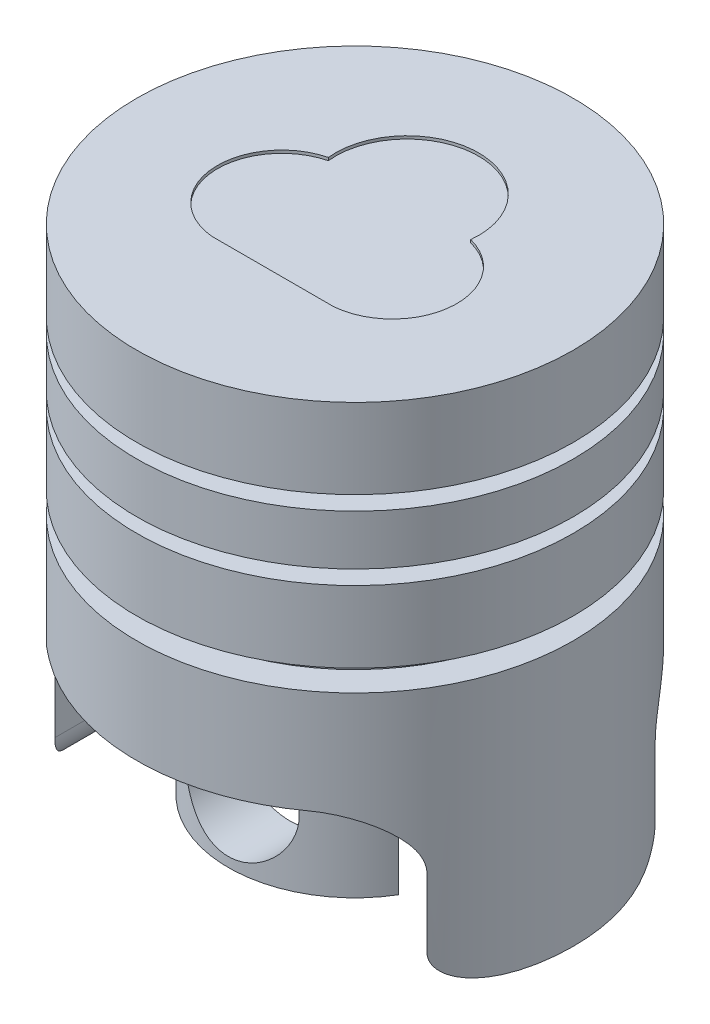
from build123d import *

# Parameters (mm, degrees)
CUT_EXTRUDE1_DEPTH      = 57.315677826
CUT_EXTRUDE1_DEPTH_BACK = 57.315677826
SKETCH2_W               = 52
SKETCH2_H               = 45
FILLET1_R               = 8
BOSS_EXTRUDE1_DEPTH     = 56
CUT_EXTRUDE2_DEPTH      = 62.715224497
CUT_EXTRUDE2_DEPTH_BACK = 62.715224497
SKETCH4_R               = 8
FILLET2_START           = -17
FILLET2_DEPTH           = 34
CUT_EXTRUDE3_DEPTH      = 0.4


with BuildPart() as part:
    # Sketch1 → Revolve1 (revolve)
    with BuildSketch(Plane.XY):
        Polygon((0, 35.952879581), (-30.5, 35.952879581), (-30.5, 24.792879581), (-26.5, 24.792879581), (-26.5, 22.792879581), (-30.5, 22.792879581), (-30.5, 15.792879581), (-26.5, 15.792879581), (-26.5, 13.792879581), (-30.5, 13.792879581), (-30.5, 3.792879581), (-26.5, 3.792879581), (-26.5, 0.792879581), (-30.5, 0.792879581), (-30.5, -36.207120419), (-17.7, -36.207120419), (-17.7, 22.952879581), (0, 22.952879581), align=None)
    revolve(axis=Axis((0, 39.251308901, 0), (0, -1, 0)))

    # Sketch2 → Cut-Extrude1 (cut, two sides: drawn at the far end of the back side and taken through both)
    with BuildSketch(Plane.XY.offset(-CUT_EXTRUDE1_DEPTH_BACK)):
        with Locations((0, -36.207120419)):
            Rectangle(SKETCH2_W, SKETCH2_H)
    extrude(amount=CUT_EXTRUDE1_DEPTH + CUT_EXTRUDE1_DEPTH_BACK, mode=Mode.SUBTRACT)

    # Fillet1
    fillet1_edges = [part.edges().sort_by_distance(p)[0] for p in [
        (26, -13.707120419, 0),
        (-26, -13.707120419, 0),
    ]]
    fillet(fillet1_edges, radius=FILLET1_R)

    # Sketch3 → Boss-Extrude1 (add)
    with BuildSketch(Plane.XZ.offset(-22.952879581)):
        with BuildLine():
            Line((-15.186081342, -9.092465753), (15.186081342, -9.092465753))
            ThreePointArc((15.186081342, -9.092465753), (0, -17.7), (-15.186081342, -9.092465753))
        make_face()
        with BuildLine():
            Line((-15.186081342, 9.092465753), (15.186081342, 9.092465753))
            ThreePointArc((15.186081342, 9.092465753), (0, 17.7), (-15.186081342, 9.092465753))
        make_face()
    extrude(amount=BOSS_EXTRUDE1_DEPTH)

    # Sketch4 → Cut-Extrude2 (cut, two sides: drawn at the far end of the back side and taken through both)
    with BuildSketch(Plane.XY.offset(-9.092465753).offset(-CUT_EXTRUDE2_DEPTH_BACK)):
        with Locations((0, -23.707120419)):
            Circle(SKETCH4_R)
    extrude(amount=CUT_EXTRUDE2_DEPTH + CUT_EXTRUDE2_DEPTH_BACK, mode=Mode.SUBTRACT)

    # Fillet2: read off the stored shape, not the designer's step
    # Fillet2 outline → Fillet2 (cut)
    with BuildSketch(Plane.XY.offset(FILLET2_START)):
        with BuildLine():
            Line((30.749452468, -36.207120419), (30.500160015, -36.182073684))
            ThreePointArc((30.500160015, -36.182073684), (27.291954698, -34.561282019), (26, -31.207120419))
            Line((26, -31.207120419), (26, -36.207120419))
            Line((26, -36.207120419), (30.749452468, -36.207120419))
        make_face()
        with BuildLine():
            Line((-26, -36.207120419), (-26, -31.207120419))
            ThreePointArc((-26, -31.207120419), (-27.291900757, -34.561222386), (-30.500000003, -36.182057605))
            Line((-30.500000003, -36.182057605), (-30.749371855, -36.207120419))
            Line((-30.749371855, -36.207120419), (-26, -36.207120419))
        make_face()
    extrude(amount=FILLET2_DEPTH, mode=Mode.SUBTRACT)

    # Sketch5 → Cut-Extrude3 (cut)
    with BuildSketch(Plane(origin=(0, 35.952879581, 0), x_dir=(1, 0, 0), z_dir=(0, 1, 0))):
        with BuildLine():
            Line((-8.5, -11.466567669), (8.5, -11.466567669))
            ThreePointArc((8.5, -11.466567669), (16.696900168, -3.232277046), (9.94436139, 6.222665285))
            ThreePointArc((9.94436139, 6.222665285), (0, 17.276077147), (-9.94436139, 6.222665285))
            ThreePointArc((-9.94436139, 6.222665285), (-16.696900168, -3.232277046), (-8.5, -11.466567669))
        make_face()
    extrude(amount=-CUT_EXTRUDE3_DEPTH, mode=Mode.SUBTRACT)


solid = part.part
